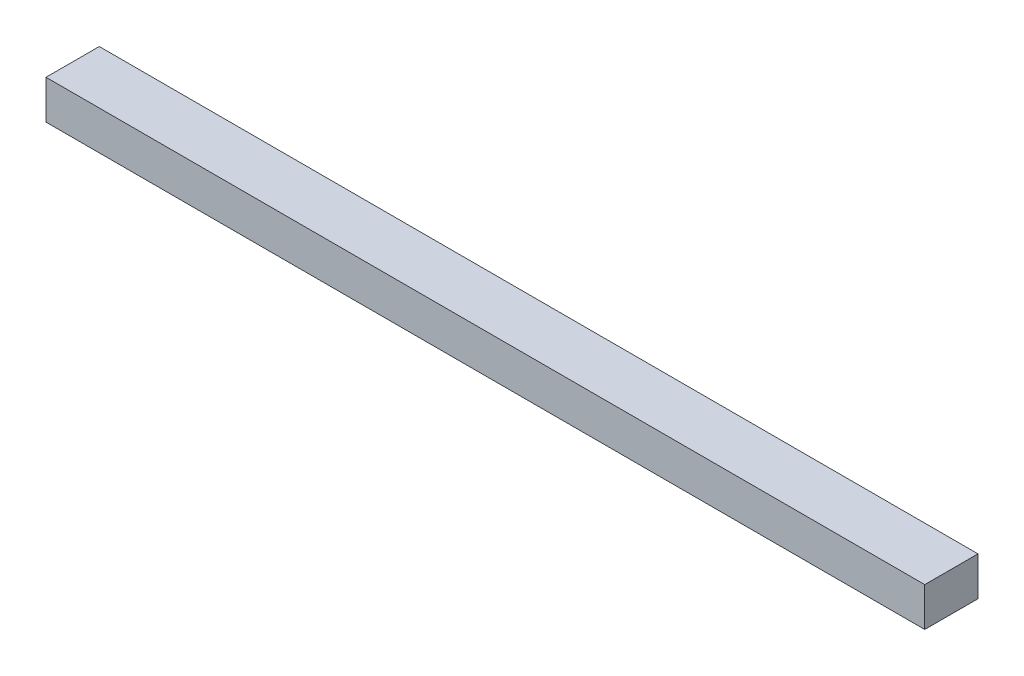
from build123d import *

# Parameters (mm, degrees)
SKETCH1_W           = 41.91
SKETCH1_H           = 2.54
BOSS_EXTRUDE1_DEPTH = 1.8542


with BuildPart() as part:
    # Sketch1 → Boss-Extrude1 (new body)
    with BuildSketch(Plane(origin=(0, 0, 0), x_dir=(1, 0, 0), z_dir=(0, 1, 0))):
        Rectangle(SKETCH1_W, SKETCH1_H)
    extrude(amount=BOSS_EXTRUDE1_DEPTH)


solid = part.part
